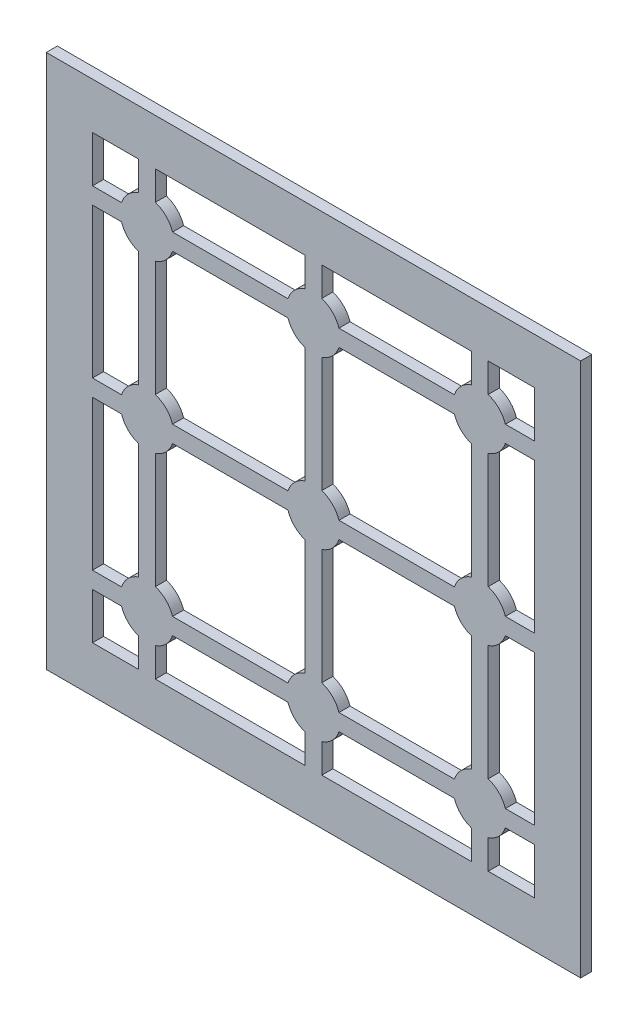
from build123d import *

# Parameters (mm, degrees)
BOSS_EXTRUDE2_DEPTH        = 0.12
CIRPATTERN2_COUNT          = 4
LPATTERN5_COUNT            = 2
LPATTERN5_PITCH            = 1.8
LPATTERN5_COPY_1_DEPTH     = 0.12
LPATTERN5_COPY_2_DEPTH     = 0.12
LPATTERN5_COPY_3_DEPTH     = 0.12
LPATTERN5_COL_COUNT        = 2
LPATTERN5_COL_PITCH        = 1.8
LPATTERN5_COL_COPY_1_DEPTH = 0.12
LPATTERN5_COL_COPY_2_DEPTH = 0.12
LPATTERN5_COL_COPY_3_DEPTH = 0.12
LPATTERN6_DEPTH            = 0.12
SKETCH3_W                  = 8
SKETCH3_H                  = 8
SKETCH3_W_2                = 4.78
SKETCH3_H_2                = 4.78
CUT_EXTRUDE8_DEPTH         = 4.820261771
SKETCH7_W                  = 5.78
SKETCH7_H                  = 5.78
SKETCH7_W_2                = 4.78
SKETCH7_H_2                = 4.78
BOSS_EXTRUDE3_DEPTH        = 0.12


# Read off the part's stored shape, not the designer's step: LPattern6
with BuildPart() as part:
    # Sketch2 → Boss-Extrude2 (new body)
    with BuildSketch(Plane.XY):
        with BuildLine():
            Line((0.09, 0.9), (0.09, 0.275680975))
            ThreePointArc((0.09, 0.275680975), (0, -0.29), (-0.09, 0.275680975))
            Line((-0.09, 0.275680975), (-0.09, 0.9))
            Line((-0.09, 0.9), (0.09, 0.9))
        make_face()
    boss_extrude2 = extrude(amount=BOSS_EXTRUDE2_DEPTH)

    # CirPattern2: Boss-Extrude2 ×4 about axis
    cirpattern2_axis = Axis((0, 0, 0), (0, 0, 1))
    for i in range(1, CIRPATTERN2_COUNT):
        add(boss_extrude2.rotate(cirpattern2_axis, i * 360 / CIRPATTERN2_COUNT))



with BuildPart() as lpattern5_1:
    # LPattern5: Boss-Extrude2 ×2
    with Locations(*[(0, i * LPATTERN5_PITCH, 0) for i in range(1, LPATTERN5_COUNT)]):
        add(boss_extrude2)

    # LPattern5 copy 1 sketch → LPattern5 copy 1 (add)
    with BuildSketch(Plane(origin=(0, 1.8, 0), x_dir=(0, 1, 0), z_dir=(0, 0, 1))):
        with BuildLine():
            Line((0.09, 0.9), (0.09, 0.275680975))
            ThreePointArc((0.09, 0.275680975), (0, -0.29), (-0.09, 0.275680975))
            Line((-0.09, 0.275680975), (-0.09, 0.9))
            Line((-0.09, 0.9), (0.09, 0.9))
        make_face()
    extrude(amount=LPATTERN5_COPY_1_DEPTH)


with BuildPart() as part_1:
    add(part.part)

    add(lpattern5_1.part)  # LPattern5 copy 2 merges LPattern5_1
    # LPattern5 copy 2 sketch → LPattern5 copy 2 (add)
    with BuildSketch(Plane(origin=(0, 1.8, 0), x_dir=(-1, 0, 0), z_dir=(0, 0, 1))):
        with BuildLine():
            Line((0.09, 0.9), (0.09, 0.275680975))
            ThreePointArc((0.09, 0.275680975), (0, -0.29), (-0.09, 0.275680975))
            Line((-0.09, 0.275680975), (-0.09, 0.9))
            Line((-0.09, 0.9), (0.09, 0.9))
        make_face()
    extrude(amount=LPATTERN5_COPY_2_DEPTH)

    # LPattern5 copy 3 sketch → LPattern5 copy 3 (add)
    with BuildSketch(Plane(origin=(0, 1.8, 0), x_dir=(0, -1, 0), z_dir=(0, 0, 1))):
        with BuildLine():
            Line((0.09, 0.9), (0.09, 0.275680975))
            ThreePointArc((0.09, 0.275680975), (0, -0.29), (-0.09, 0.275680975))
            Line((-0.09, 0.275680975), (-0.09, 0.9))
            Line((-0.09, 0.9), (0.09, 0.9))
        make_face()
    extrude(amount=LPATTERN5_COPY_3_DEPTH)

    # LPattern5 col: Boss-Extrude2 ×2
    with Locations(*[(0, -i * LPATTERN5_COL_PITCH, 0) for i in range(1, LPATTERN5_COL_COUNT)]):
        add(boss_extrude2)

    # LPattern5 col copy 1 sketch → LPattern5 col copy 1 (add)
    with BuildSketch(Plane(origin=(0, -1.8, 0), x_dir=(0, 1, 0), z_dir=(0, 0, 1))):
        with BuildLine():
            Line((0.09, 0.9), (0.09, 0.275680975))
            ThreePointArc((0.09, 0.275680975), (0, -0.29), (-0.09, 0.275680975))
            Line((-0.09, 0.275680975), (-0.09, 0.9))
            Line((-0.09, 0.9), (0.09, 0.9))
        make_face()
    extrude(amount=LPATTERN5_COL_COPY_1_DEPTH)

    # LPattern5 col copy 2 sketch → LPattern5 col copy 2 (add)
    with BuildSketch(Plane(origin=(0, -1.8, 0), x_dir=(-1, 0, 0), z_dir=(0, 0, 1))):
        with BuildLine():
            Line((0.09, 0.9), (0.09, 0.275680975))
            ThreePointArc((0.09, 0.275680975), (0, -0.29), (-0.09, 0.275680975))
            Line((-0.09, 0.275680975), (-0.09, 0.9))
            Line((-0.09, 0.9), (0.09, 0.9))
        make_face()
    extrude(amount=LPATTERN5_COL_COPY_2_DEPTH)

    # LPattern5 col copy 3 sketch → LPattern5 col copy 3 (add)
    with BuildSketch(Plane(origin=(0, -1.8, 0), x_dir=(0, -1, 0), z_dir=(0, 0, 1))):
        with BuildLine():
            Line((0.09, 0.9), (0.09, 0.275680975))
            ThreePointArc((0.09, 0.275680975), (0, -0.29), (-0.09, 0.275680975))
            Line((-0.09, 0.275680975), (-0.09, 0.9))
            Line((-0.09, 0.9), (0.09, 0.9))
        make_face()
    extrude(amount=LPATTERN5_COL_COPY_3_DEPTH)

    # LPattern6 outline → LPattern6 (add)
    with BuildSketch(Plane.XY):
        with BuildLine():
            Line((1.524319025, 0.09), (0.9, 0.09))
            Line((0.9, 0.09), (0.9, -0.09))
            Line((0.9, -0.09), (1.524319025, -0.09))
            ThreePointArc((1.524319025, -0.09), (1.594939033, -0.205060967), (1.71, -0.275680975))
            Line((1.71, -0.275680975), (1.71, -1.524319025))
            ThreePointArc((1.71, -1.524319025), (1.594939033, -1.594939033), (1.524319025, -1.71))
            Line((1.524319025, -1.71), (0.9, -1.71))
            Line((0.9, -1.71), (0.9, -1.89))
            Line((0.9, -1.89), (1.524319025, -1.89))
            ThreePointArc((1.524319025, -1.89), (1.594939033, -2.005060967), (1.71, -2.075680975))
            Line((1.71, -2.075680975), (1.71, -2.7))
            Line((1.71, -2.7), (1.89, -2.7))
            Line((1.89, -2.7), (1.89, -2.075680975))
            ThreePointArc((1.89, -2.075680975), (2.005060967, -2.005060967), (2.075680975, -1.89))
            Line((2.075680975, -1.89), (2.7, -1.89))
            Line((2.7, -1.89), (2.7, -1.71))
            Line((2.7, -1.71), (2.075680975, -1.71))
            ThreePointArc((2.075680975, -1.71), (2.005060967, -1.594939033), (1.89, -1.524319025))
            Line((1.89, -1.524319025), (1.89, -0.275680975))
            ThreePointArc((1.89, -0.275680975), (2.005060967, -0.205060967), (2.075680975, -0.09))
            Line((2.075680975, -0.09), (2.7, -0.09))
            Line((2.7, -0.09), (2.7, 0.09))
            Line((2.7, 0.09), (2.075680975, 0.09))
            ThreePointArc((2.075680975, 0.09), (2.005060967, 0.205060967), (1.89, 0.275680975))
            Line((1.89, 0.275680975), (1.89, 1.524319025))
            ThreePointArc((1.89, 1.524319025), (2.005060967, 1.594939033), (2.075680975, 1.71))
            Line((2.075680975, 1.71), (2.7, 1.71))
            Line((2.7, 1.71), (2.7, 1.89))
            Line((2.7, 1.89), (2.075680975, 1.89))
            ThreePointArc((2.075680975, 1.89), (2.005060967, 2.005060967), (1.89, 2.075680975))
            Line((1.89, 2.075680975), (1.89, 2.7))
            Line((1.89, 2.7), (1.71, 2.7))
            Line((1.71, 2.7), (1.71, 2.075680975))
            ThreePointArc((1.71, 2.075680975), (1.594939033, 2.005060967), (1.524319025, 1.89))
            Line((1.524319025, 1.89), (0.9, 1.89))
            Line((0.9, 1.89), (0.9, 1.71))
            Line((0.9, 1.71), (1.524319025, 1.71))
            ThreePointArc((1.524319025, 1.71), (1.594939033, 1.594939033), (1.71, 1.524319025))
            Line((1.71, 1.524319025), (1.71, 0.275680975))
            ThreePointArc((1.71, 0.275680975), (1.594939033, 0.205060967), (1.524319025, 0.09))
        make_face()
        with BuildLine():
            Line((-0.9, -0.09), (-0.9, 0.09))
            Line((-0.9, 0.09), (-1.524319025, 0.09))
            ThreePointArc((-1.524319025, 0.09), (-1.594939033, 0.205060967), (-1.71, 0.275680975))
            Line((-1.71, 0.275680975), (-1.71, 1.524319025))
            ThreePointArc((-1.71, 1.524319025), (-1.594939033, 1.594939033), (-1.524319025, 1.71))
            Line((-1.524319025, 1.71), (-0.9, 1.71))
            Line((-0.9, 1.71), (-0.9, 1.89))
            Line((-0.9, 1.89), (-1.524319025, 1.89))
            ThreePointArc((-1.524319025, 1.89), (-1.594939033, 2.005060967), (-1.71, 2.075680975))
            Line((-1.71, 2.075680975), (-1.71, 2.7))
            Line((-1.71, 2.7), (-1.89, 2.7))
            Line((-1.89, 2.7), (-1.89, 2.075680975))
            ThreePointArc((-1.89, 2.075680975), (-2.005060967, 2.005060967), (-2.075680975, 1.89))
            Line((-2.075680975, 1.89), (-2.7, 1.89))
            Line((-2.7, 1.89), (-2.7, 1.71))
            Line((-2.7, 1.71), (-2.075680975, 1.71))
            ThreePointArc((-2.075680975, 1.71), (-2.005060967, 1.594939033), (-1.89, 1.524319025))
            Line((-1.89, 1.524319025), (-1.89, 0.275680975))
            ThreePointArc((-1.89, 0.275680975), (-2.005060967, 0.205060967), (-2.075680975, 0.09))
            Line((-2.075680975, 0.09), (-2.7, 0.09))
            Line((-2.7, 0.09), (-2.7, -0.09))
            Line((-2.7, -0.09), (-2.075680975, -0.09))
            ThreePointArc((-2.075680975, -0.09), (-2.005060967, -0.205060967), (-1.89, -0.275680975))
            Line((-1.89, -0.275680975), (-1.89, -1.524319025))
            ThreePointArc((-1.89, -1.524319025), (-2.005060967, -1.594939033), (-2.075680975, -1.71))
            Line((-2.075680975, -1.71), (-2.7, -1.71))
            Line((-2.7, -1.71), (-2.7, -1.89))
            Line((-2.7, -1.89), (-2.075680975, -1.89))
            ThreePointArc((-2.075680975, -1.89), (-2.005060967, -2.005060967), (-1.89, -2.075680975))
            Line((-1.89, -2.075680975), (-1.89, -2.7))
            Line((-1.89, -2.7), (-1.71, -2.7))
            Line((-1.71, -2.7), (-1.71, -2.075680975))
            ThreePointArc((-1.71, -2.075680975), (-1.594939033, -2.005060967), (-1.524319025, -1.89))
            Line((-1.524319025, -1.89), (-0.9, -1.89))
            Line((-0.9, -1.89), (-0.9, -1.71))
            Line((-0.9, -1.71), (-1.524319025, -1.71))
            ThreePointArc((-1.524319025, -1.71), (-1.594939033, -1.594939033), (-1.71, -1.524319025))
            Line((-1.71, -1.524319025), (-1.71, -0.275680975))
            ThreePointArc((-1.71, -0.275680975), (-1.594939033, -0.205060967), (-1.524319025, -0.09))
            Line((-1.524319025, -0.09), (-0.9, -0.09))
        make_face()
    extrude(amount=LPATTERN6_DEPTH)

    # Sketch3 → Cut-Extrude8 (cut, through all)
    with BuildSketch(Plane.XY):
        Rectangle(SKETCH3_W, SKETCH3_H)
        Rectangle(SKETCH3_W_2, SKETCH3_H_2, mode=Mode.SUBTRACT)
    extrude(amount=CUT_EXTRUDE8_DEPTH, mode=Mode.SUBTRACT)

    # Sketch7 → Boss-Extrude3 (add)
    with BuildSketch(Plane.XY.offset(0.12)):
        Rectangle(SKETCH7_W, SKETCH7_H)
        Rectangle(SKETCH7_W_2, SKETCH7_H_2, mode=Mode.SUBTRACT)
    extrude(amount=-BOSS_EXTRUDE3_DEPTH)


solid = part_1.part
